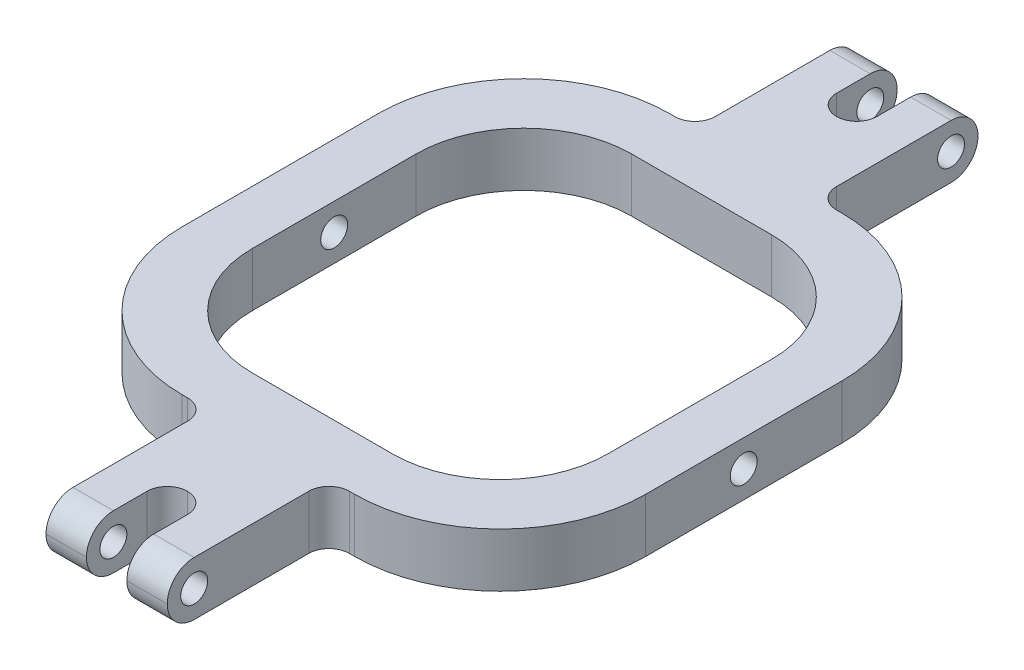
from build123d import *

# Parameters (mm, degrees)
BOSS_EXTRUDE1_DEPTH      = 3.175
BOSS_EXTRUDE1_DEPTH_BACK = 3.175
SKETCH1_W                = 41.91
SKETCH1_H                = 44.704
CUT_EXTRUDE1_DEPTH       = 56.115992998
CUT_EXTRUDE1_DEPTH_BACK  = 56.115992998
SKETCH2_R                = 1.5875
FILLET1_R                = 3.175
FILLET2_R                = 12.7
FILLET4_R                = 2.38125
FILLET3_R                = 17.145


with BuildPart() as part:
    # Sketch1 → Boss-Extrude1 (new, two sides: drawn at the far end of the back side and taken through both)
    with BuildSketch(Plane(origin=(0, 0, 0), x_dir=(1, 0, 0), z_dir=(0, 1, 0)).offset(-BOSS_EXTRUDE1_DEPTH_BACK)):
        Polygon((-2.38125, -38.2466342), (2.38125, -38.2466342), (2.38125, -47.7716342), (7.14375, -47.7716342), (7.14375, -28.702), (27.305, -28.702), (27.305, 28.702), (7.14375, 28.702), (7.14375, 47.7716342), (2.38125, 47.7716342), (2.38125, 38.2466342), (-2.38125, 38.2466342), (-2.38125, 47.7716342), (-7.14375, 47.7716342), (-7.14375, 28.702), (-27.305, 28.702), (-27.305, -28.702), (-7.14375, -28.702), (-7.14375, -47.7716342), (-2.38125, -47.7716342), align=None)
        Rectangle(SKETCH1_W, SKETCH1_H, mode=Mode.SUBTRACT)
    extrude(amount=BOSS_EXTRUDE1_DEPTH + BOSS_EXTRUDE1_DEPTH_BACK)

    # Sketch2 → Cut-Extrude1 (cut, two sides: drawn at the far end of the back side and taken through both)
    with BuildSketch(Plane(origin=(0, 0, 0), x_dir=(0, 0, -1), z_dir=(1, 0, 0)).offset(-CUT_EXTRUDE1_DEPTH_BACK)):
        Circle(SKETCH2_R)
        with Locations((44.5966342, 0)):
            Circle(SKETCH2_R)
        with Locations((-44.5966342, 0)):
            Circle(SKETCH2_R)
    extrude(amount=CUT_EXTRUDE1_DEPTH + CUT_EXTRUDE1_DEPTH_BACK, mode=Mode.SUBTRACT)

    # Fillet1
    fillet1_edges = [part.edges().sort_by_distance(p)[0] for p in [
        (-4.7625, -3.175, 47.7716342),
        (-4.7625, 3.175, 47.7716342),
        (4.7625, 3.175, 47.7716342),
        (4.7625, -3.175, 47.7716342),
        (4.7625, -3.175, -47.7716342),
        (-4.7625, -3.175, -47.7716342),
        (4.7625, 3.175, -47.7716342),
        (-4.7625, 3.175, -47.7716342),
    ]]
    fillet(fillet1_edges, radius=FILLET1_R - 0.0001)  # a hair under: the kernel refuses the full size

    # Fillet2
    fillet2_edges = [part.edges().sort_by_distance(p)[0] for p in [
        (-20.955, 0, -22.352),
        (20.955, 0, -22.352),
        (20.955, 0, 22.352),
        (-20.955, 0, 22.352),
    ]]
    fillet(fillet2_edges, radius=FILLET2_R)

    # Fillet4
    fillet4_edges = [part.edges().sort_by_distance(p)[0] for p in [
        (7.14375, 0, 28.702),
        (-7.14375, 0, 28.702),
        (7.14375, 0, -28.702),
        (-7.14375, 0, -28.702),
        (-2.38125, 0, -38.2466342),
        (2.38125, 0, -38.2466342),
        (-2.38125, 0, 38.2466342),
        (2.38125, 0, 38.2466342),
    ]]
    fillet(fillet4_edges, radius=FILLET4_R - 0.0001)  # a hair under: the kernel refuses the full size

    # Fillet3
    fillet3_edges = [part.edges().sort_by_distance(p)[0] for p in [
        (-27.305, 0, 28.702),
        (-27.305, 0, -28.702),
        (27.305, 0, -28.702),
        (27.305, 0, 28.702),
    ]]
    fillet(fillet3_edges, radius=FILLET3_R)


solid = part.part
